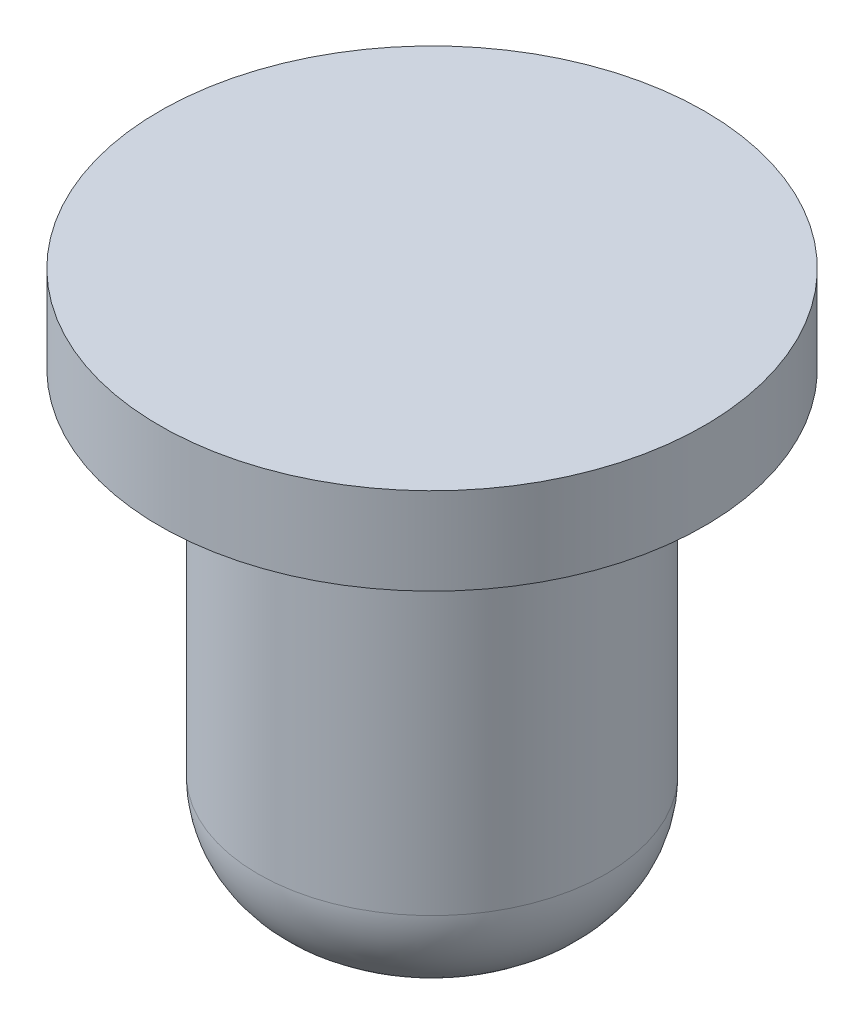
from build123d import *


with BuildPart() as part:
    # Sketch1 → Revolve1 (revolve)
    with BuildSketch(Plane.XY):
        with BuildLine():
            Line((0, 18.626666667), (19.896666667, 18.626666667))
            Line((19.896666667, 18.626666667), (19.896666667, 12.276666667))
            Line((19.896666667, 12.276666667), (12.7, 12.276666667))
            Line((12.7, 12.276666667), (12.7, -13.335))
            ThreePointArc((12.7, -13.335), (10.468153673, -18.723153673), (5.08, -20.955))
            Line((5.08, -20.955), (0, -20.955))
            Line((0, -20.955), (0, 18.626666667))
        make_face()
    revolve(axis=Axis((0, -20.955, 0), (0, 1, 0)))


solid = part.part
